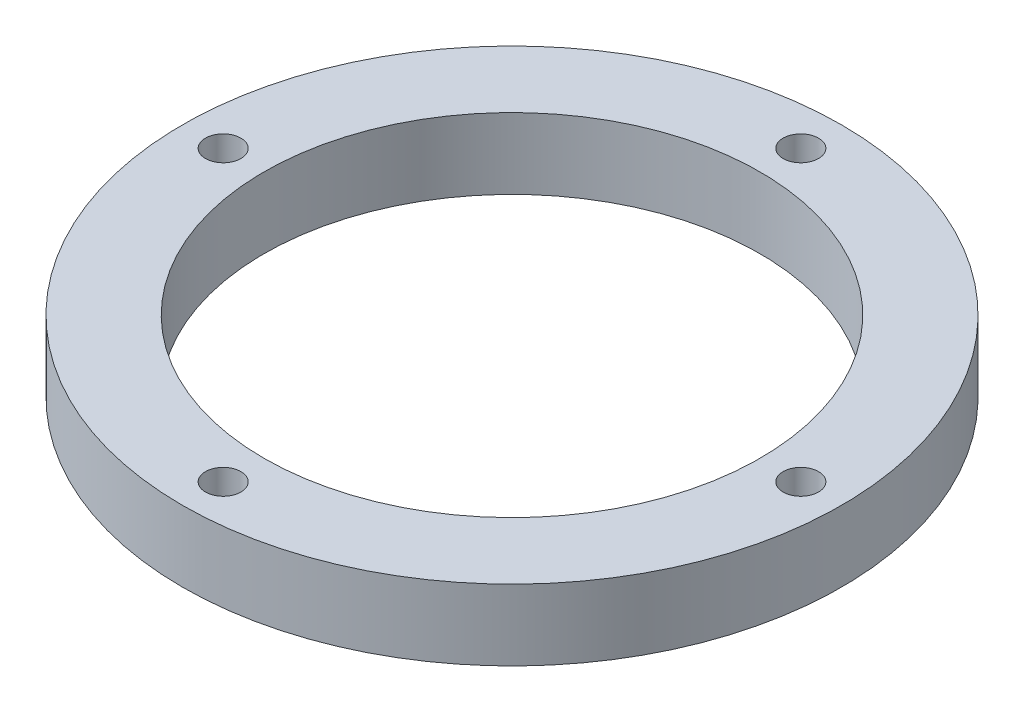
from build123d import *

# Parameters (mm, degrees)
SKETCH1_R           = 46.5
SKETCH1_R_2         = 35
SKETCH1_R_3         = 2.5
BOSS_EXTRUDE1_DEPTH = 10


with BuildPart() as part:
    # Sketch1 → Boss-Extrude1 (new body)
    with BuildSketch(Plane(origin=(0, 0, 0), x_dir=(1, 0, 0), z_dir=(0, 1, 0))):
        Circle(SKETCH1_R)
        Circle(SKETCH1_R_2, mode=Mode.SUBTRACT)
        with Locations((-40.75, 0)):
            Circle(SKETCH1_R_3, mode=Mode.SUBTRACT)
        with Locations((0, 40.75)):
            Circle(SKETCH1_R_3, mode=Mode.SUBTRACT)
        with Locations((40.75, 0)):
            Circle(SKETCH1_R_3, mode=Mode.SUBTRACT)
        with Locations((0, -40.75)):
            Circle(SKETCH1_R_3, mode=Mode.SUBTRACT)
    extrude(amount=BOSS_EXTRUDE1_DEPTH)


solid = part.part
